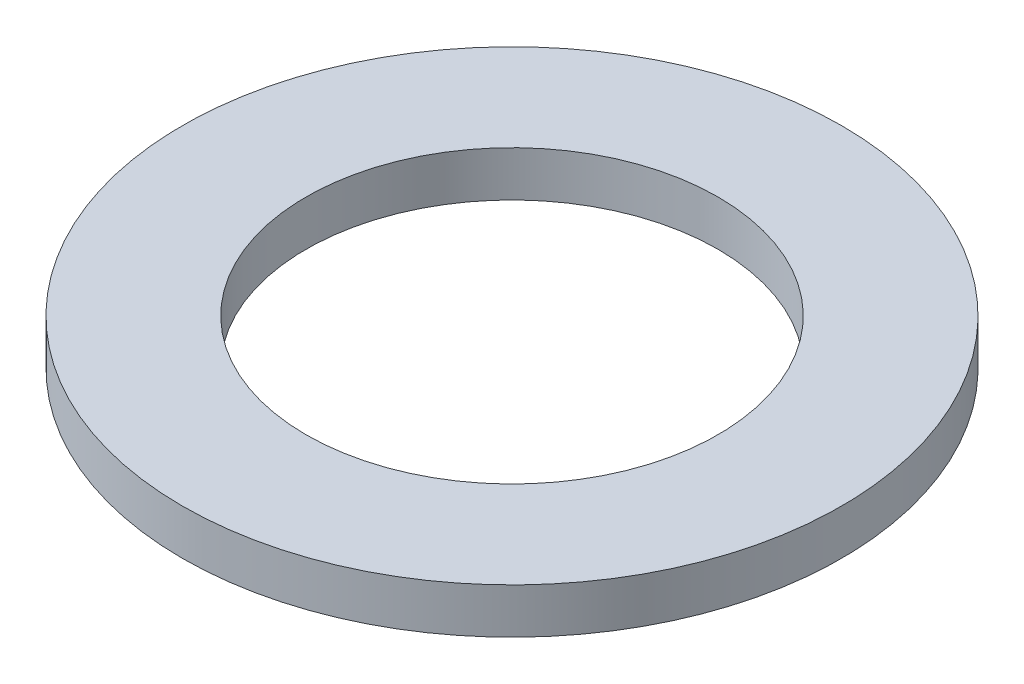
from build123d import *

# Parameters (mm, degrees)
SKETCH1_R           = 80
BOSS_EXTRUDE1_DEPTH = 11
SKETCH2_R           = 50
CUT_EXTRUDE1_DEPTH  = 114.670576668


with BuildPart() as part:
    # Sketch1 → Boss-Extrude1 (new body)
    with BuildSketch(Plane(origin=(0, 0, 0), x_dir=(1, 0, 0), z_dir=(0, 1, 0))):
        Circle(SKETCH1_R)
    extrude(amount=BOSS_EXTRUDE1_DEPTH)

    # Sketch2 → Cut-Extrude1 (cut, through all)
    with BuildSketch(Plane(origin=(0, 0, 0), x_dir=(1, 0, 0), z_dir=(0, 1, 0))):
        Circle(SKETCH2_R)
    extrude(amount=CUT_EXTRUDE1_DEPTH, mode=Mode.SUBTRACT)


solid = part.part
